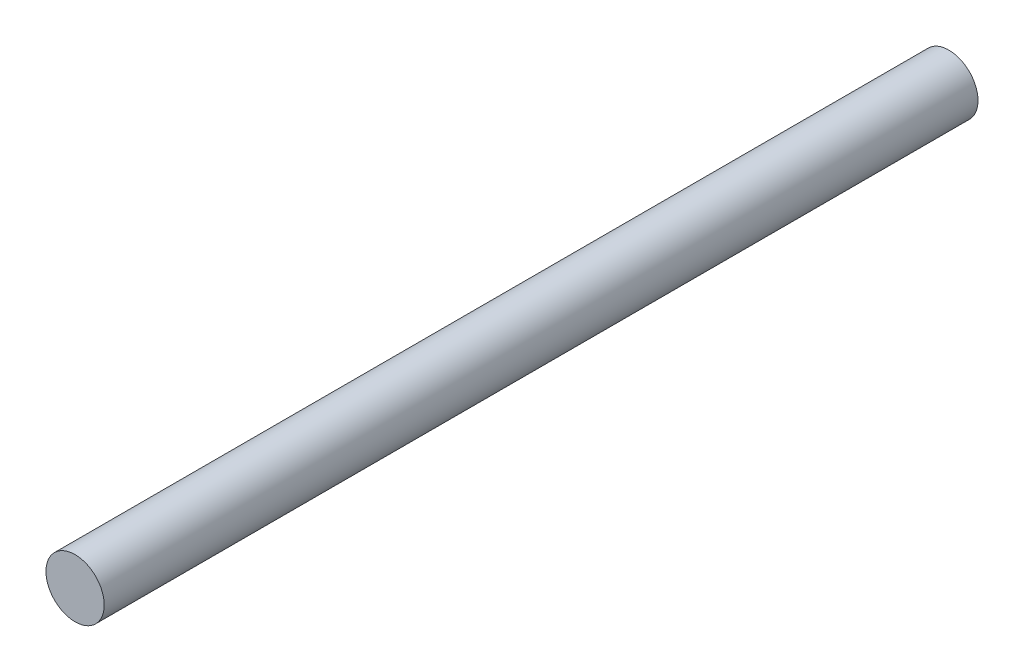
from build123d import *

# Parameters (mm, degrees)
SKETCH1_W = 4
SKETCH1_H = 120


with BuildPart() as part:
    # Sketch1 → Revolve1 (revolve)
    with BuildSketch(Plane(origin=(0, 0, 0), x_dir=(1, 0, 0), z_dir=(0, 1, 0))):
        with Locations((-2, -60)):
            Rectangle(SKETCH1_W, SKETCH1_H)
    revolve(axis=Axis((0, 0, 48.709374581), (0, 0, -1)))


solid = part.part
